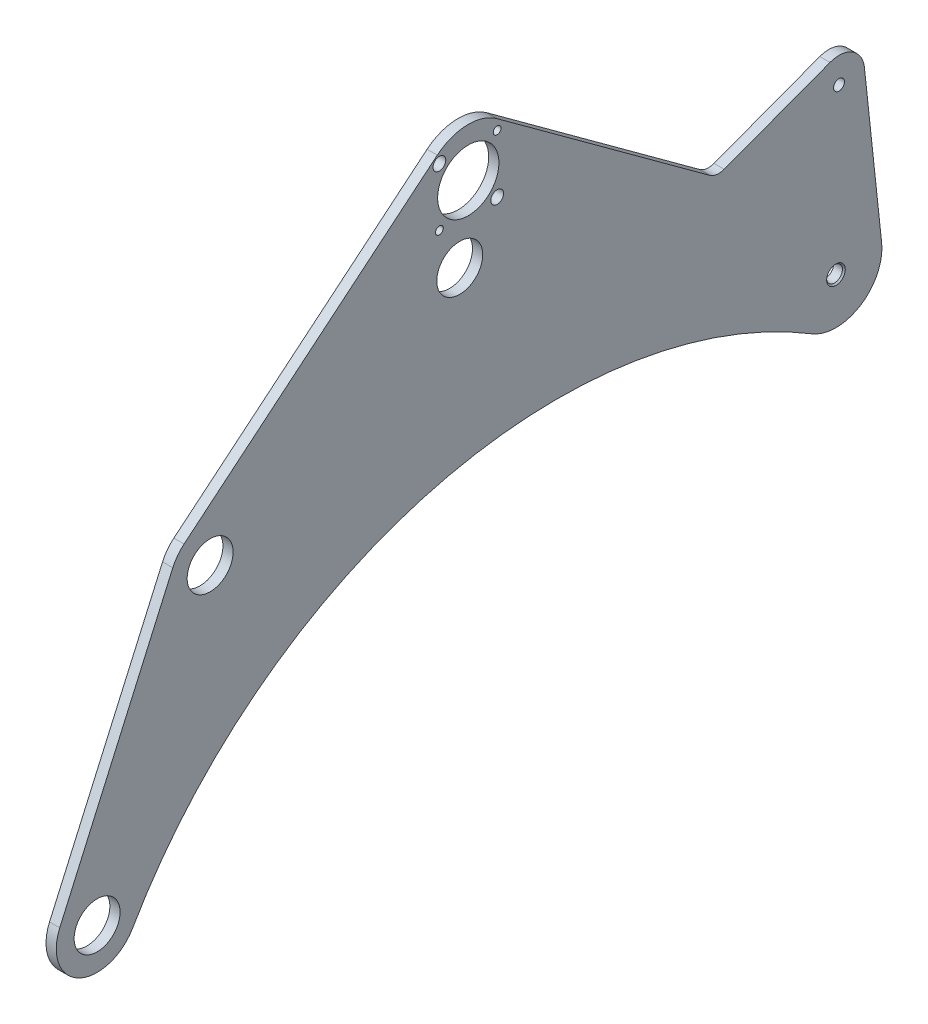
from build123d import *

# Parameters (mm, degrees)
SKETCH2_R                         = 3.3782
BOSS_EXTRUDE1_DEPTH               = 6.35
CUT_EXTRUDE1_REACH                = 524.664
SKETCH3_R                         = 14.2875
SKETCH3_R_2                       = 19.05
SKETCH3_R_3                       = 2.413
SKETCH3_R_4                       = 3.96875
F_3_8_CLEARANCE_HOLE2_D           = 9.8044
F_3_8_CLEARANCE_HOLE2_CSINK_D     = 11.58748
F_3_8_CLEARANCE_HOLE2_CSINK_ANGLE = 90


with BuildPart() as part:
    # Sketch2 → Boss-Extrude1 (new body)
    with BuildSketch(Plane(origin=(0, 0, 0), x_dir=(0, 0, -1), z_dir=(1, 0, 0))):
        with BuildLine():
            Line((-482.60379809, -110.367631362), (-412.322756293, 48.382368638))
            ThreePointArc((-412.322756293, 48.382368638), (-409.356755671, 53.420078169), (-405.317550321, 57.646246309))
            Line((-405.317550321, 57.646246309), (-247.861830388, 188.311167492))
            ThreePointArc((-247.861830388, 188.311167492), (-229.528335431, 195.248210554), (-210.802762557, 189.452304729))
            Line((-210.802762557, 189.452304729), (-78.456648599, 92.730649798))
            ThreePointArc((-78.456648599, 92.730649798), (-74.131961742, 90.984362438), (-69.496666533, 91.500573896))
            Line((-69.496666533, 91.500573896), (-3.674756132, 116.144665826))
            ThreePointArc((-3.674756132, 116.144665826), (10.226527631, 114.788431583), (17.675736345, 102.973426245))
            Line((17.675736345, 102.973426245), (28.411480998, 3.05260094))
            ThreePointArc((28.411480998, 3.05260094), (15.327282557, -24.116488849), (-14.82663888, -24.427472332))
            ThreePointArc((-14.82663888, -24.427472332), (-249.026478812, 10.173094114), (-437.347284158, -133.291321323))
            ThreePointArc((-437.347284158, -133.291321323), (-470.855508227, -143.308975656), (-482.60379809, -110.367631362))
        make_face()
        with Locations((1.891580235, 101.277536834)):
            Circle(SKETCH2_R, mode=Mode.SUBTRACT)
    extrude(amount=BOSS_EXTRUDE1_DEPTH)

    # Sketch3 → Cut-Extrude1 (cut, up to next)
    with BuildSketch(Plane(origin=(6.35, 0, 0), x_dir=(0, 0, -1), z_dir=(1, 0, 0)), mode=Mode.PRIVATE) as cut_extrude1_sk1:
        with Locations((-233.920974527, 120.65)):
            Circle(SKETCH3_R)
    cut_extrude1_tool1 = extrude(cut_extrude1_sk1.sketch, amount=-CUT_EXTRUDE1_REACH, mode=Mode.PRIVATE) & part.part
    # Sketch3 → Cut-Extrude1 (cut, up to next)
    with BuildSketch(Plane(origin=(6.35, 0, 0), x_dir=(0, 0, -1), z_dir=(1, 0, 0)), mode=Mode.PRIVATE) as cut_extrude1_sk2:
        with Locations((-389.097061574, 38.1)):
            Circle(SKETCH3_R)
    cut_extrude1_tool2 = extrude(cut_extrude1_sk2.sketch, amount=-CUT_EXTRUDE1_REACH, mode=Mode.PRIVATE) & part.part
    # Sketch3 → Cut-Extrude1 (cut, up to next)
    with BuildSketch(Plane(origin=(6.35, 0, 0), x_dir=(0, 0, -1), z_dir=(1, 0, 0)), mode=Mode.PRIVATE) as cut_extrude1_sk3:
        with Locations((-459.378103371, -120.65)):
            Circle(SKETCH3_R)
    cut_extrude1_tool3 = extrude(cut_extrude1_sk3.sketch, amount=-CUT_EXTRUDE1_REACH, mode=Mode.PRIVATE) & part.part
    # Sketch3 → Cut-Extrude1 (cut, up to next)
    with BuildSketch(Plane(origin=(6.35, 0, 0), x_dir=(0, 0, -1), z_dir=(1, 0, 0)), mode=Mode.PRIVATE) as cut_extrude1_sk4:
        with Locations((-228.6, 165.1)):
            Circle(SKETCH3_R_2)
    cut_extrude1_tool4 = extrude(cut_extrude1_sk4.sketch, amount=-CUT_EXTRUDE1_REACH, mode=Mode.PRIVATE) & part.part
    # Sketch3 → Cut-Extrude1 (cut, up to next)
    with BuildSketch(Plane(origin=(6.35, 0, 0), x_dir=(0, 0, -1), z_dir=(1, 0, 0)), mode=Mode.PRIVATE) as cut_extrude1_sk5:
        with Locations((-246.560512242, 147.139487758)):
            Circle(SKETCH3_R_3)
    cut_extrude1_tool5 = extrude(cut_extrude1_sk5.sketch, amount=-CUT_EXTRUDE1_REACH, mode=Mode.PRIVATE) & part.part
    # Sketch3 → Cut-Extrude1 (cut, up to next)
    with BuildSketch(Plane(origin=(6.35, 0, 0), x_dir=(0, 0, -1), z_dir=(1, 0, 0)), mode=Mode.PRIVATE) as cut_extrude1_sk6:
        with Locations((-210.639487758, 147.139487758)):
            Circle(SKETCH3_R_4)
    cut_extrude1_tool6 = extrude(cut_extrude1_sk6.sketch, amount=-CUT_EXTRUDE1_REACH, mode=Mode.PRIVATE) & part.part
    # Sketch3 → Cut-Extrude1 (cut, up to next)
    with BuildSketch(Plane(origin=(6.35, 0, 0), x_dir=(0, 0, -1), z_dir=(1, 0, 0)), mode=Mode.PRIVATE) as cut_extrude1_sk7:
        with Locations((-210.639487758, 183.060512242)):
            Circle(SKETCH3_R_3)
    cut_extrude1_tool7 = extrude(cut_extrude1_sk7.sketch, amount=-CUT_EXTRUDE1_REACH, mode=Mode.PRIVATE) & part.part
    # Sketch3 → Cut-Extrude1 (cut, up to next)
    with BuildSketch(Plane(origin=(6.35, 0, 0), x_dir=(0, 0, -1), z_dir=(1, 0, 0)), mode=Mode.PRIVATE) as cut_extrude1_sk8:
        with Locations((-246.560512242, 183.060512242)):
            Circle(SKETCH3_R_4)
    cut_extrude1_tool8 = extrude(cut_extrude1_sk8.sketch, amount=-CUT_EXTRUDE1_REACH, mode=Mode.PRIVATE) & part.part
    add(cut_extrude1_tool1.solids().sort_by_distance((6.35, 120.65, 233.920975))[0], mode=Mode.SUBTRACT)
    add(cut_extrude1_tool2.solids().sort_by_distance((6.35, 38.1, 389.097062))[0], mode=Mode.SUBTRACT)
    add(cut_extrude1_tool3.solids().sort_by_distance((6.35, -120.65, 459.378103))[0], mode=Mode.SUBTRACT)
    add(cut_extrude1_tool4.solids().sort_by_distance((6.35, 165.1, 228.6))[0], mode=Mode.SUBTRACT)
    add(cut_extrude1_tool5.solids().sort_by_distance((6.35, 147.139488, 246.560512))[0], mode=Mode.SUBTRACT)
    add(cut_extrude1_tool6.solids().sort_by_distance((6.35, 147.139488, 210.639488))[0], mode=Mode.SUBTRACT)
    add(cut_extrude1_tool7.solids().sort_by_distance((6.35, 183.060512, 210.639488))[0], mode=Mode.SUBTRACT)
    add(cut_extrude1_tool8.solids().sort_by_distance((6.35, 183.060512, 246.560512))[0], mode=Mode.SUBTRACT)

    # 3/8 Clearance Hole2 (through all)
    with Locations(Plane(origin=(6.35, 0, 0), x_dir=(0, 0, -1), z_dir=(1, 0, 0))):
        with Locations((0, 0)):
            CounterSinkHole(F_3_8_CLEARANCE_HOLE2_D / 2, F_3_8_CLEARANCE_HOLE2_CSINK_D / 2, counter_sink_angle=F_3_8_CLEARANCE_HOLE2_CSINK_ANGLE)


solid = part.part
